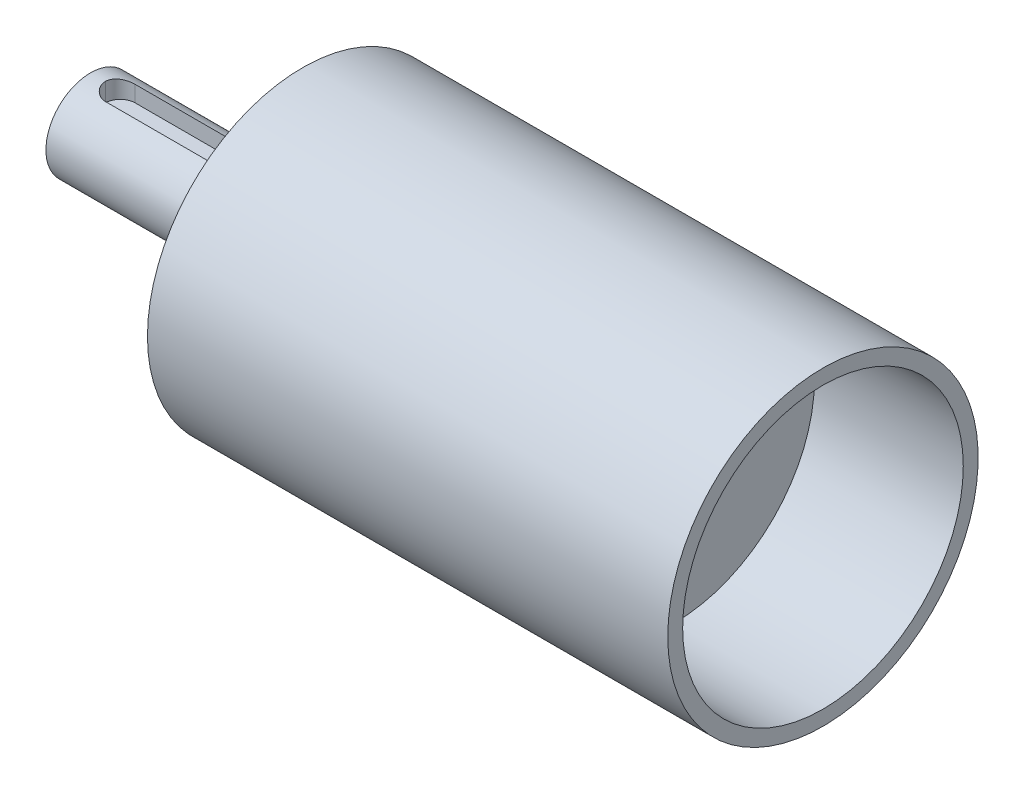
from build123d import *

# Parameters (mm, degrees)
SKETCH1_R          = 5.99
EXTRUDE1_DEPTH     = 25.9
SKETCH2_R          = 13.985
EXTRUDE2_DEPTH     = 2.6
SKETCH3_R          = 20.85
EXTRUDE3_DEPTH     = 69.9
CUT_EXTRUDE1_START = -2
CUT_EXTRUDE1_DEPTH = 20
FILLET8_R          = 2
SKETCH7_R          = 2
CUT_EXTRUDE2_DEPTH = 8
SKETCH9_R          = 18.85
CUT_EXTRUDE3_DEPTH = 20


with BuildPart() as part:
    # Sketch1 → Extrude1 (new body)
    with BuildSketch(Plane(origin=(0, 0, 0), x_dir=(0, 0, -1), z_dir=(1, 0, 0))):
        with Locations(Location((0, 0, 0), (0, 0, 180))):
            Circle(SKETCH1_R)
    extrude(amount=EXTRUDE1_DEPTH)

    # Sketch2 → Extrude2 (add)
    with BuildSketch(Plane(origin=(25.9, 0, 0), x_dir=(0, 0, -1), z_dir=(1, 0, 0))):
        Circle(SKETCH2_R)
    extrude(amount=EXTRUDE2_DEPTH)

    # Sketch3 → Extrude3 (add)
    with BuildSketch(Plane(origin=(28.5, 0, 0), x_dir=(0, 0, -1), z_dir=(1, 0, 0))):
        with Locations(Location((0, 0, 0), (0, 0, 180))):
            Circle(SKETCH3_R)
    extrude(amount=EXTRUDE3_DEPTH)

    # Sketch6 → Cut-Extrude1 (cut)
    with BuildSketch(Plane.ZY.offset(CUT_EXTRUDE1_START)):
        with BuildLine():
            Line((0, 3.49), (0, 5.99))
            ThreePointArc((0, 5.99), (-1.014663299, 5.903436151), (-2, 5.646246541))
            Line((-2, 5.646246541), (-2, 3.49))
            Line((-2, 3.49), (0, 3.49))
        make_face()
        with BuildLine():
            ThreePointArc((2, 5.646246541), (1.014663299, 5.903436151), (0, 5.99))
            Line((0, 5.99), (0, 3.49))
            Line((0, 3.49), (2, 3.49))
            Line((2, 3.49), (2, 5.646246541))
        make_face()
    extrude(amount=-CUT_EXTRUDE1_DEPTH, mode=Mode.SUBTRACT)

    # Fillet8
    fillet8_edges = [part.edges().sort_by_distance(p)[0] for p in [
        (2, 4.56812327, -2),
        (22, 4.56812327, -2),
        (2, 4.56812327, 2),
        (22, 4.56812327, 2),
    ]]
    fillet(fillet8_edges, radius=FILLET8_R - 0.0001)  # a hair under: the kernel refuses the full size

    # Sketch7 → Cut-Extrude2 (cut)
    with BuildSketch(Plane.ZY.offset(-28.5)):
        with Locations((0, 17.5)):
            Circle(SKETCH7_R)
        with Locations((17.5, 0)):
            Circle(SKETCH7_R)
        with Locations((0, -17.5)):
            Circle(SKETCH7_R)
        with Locations((-17.5, 0)):
            Circle(SKETCH7_R)
    extrude(amount=-CUT_EXTRUDE2_DEPTH, mode=Mode.SUBTRACT)

    # Sketch9 → Cut-Extrude3 (cut)
    with BuildSketch(Plane(origin=(98.4, 0, 0), x_dir=(0, 0, -1), z_dir=(1, 0, 0))):
        Circle(SKETCH9_R)
    extrude(amount=-CUT_EXTRUDE3_DEPTH, mode=Mode.SUBTRACT)


solid = part.part
